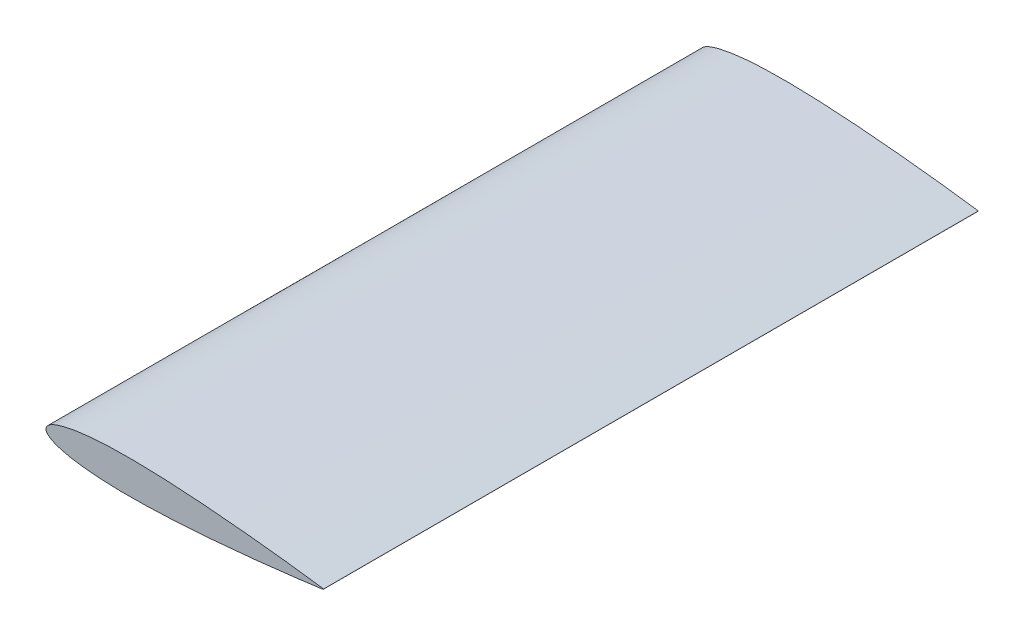
from build123d import *

# Parameters (mm, degrees)
BOSS_EXTRUDE1_DEPTH      = 269.875
BOSS_EXTRUDE1_DEPTH_BACK = 269.875


with BuildPart() as part:
    # Sketch1 → Boss-Extrude1 (new, two sides: drawn at the far end of the back side and taken through both)
    with BuildSketch(Plane.XY.offset(-BOSS_EXTRUDE1_DEPTH_BACK)):
        with BuildLine():
            add(Edge.make_bspline(
                [(-72.489557568, 12.491657943), (-72.489557568, 12.163179949), (-72.395425024, 11.48934067), (-71.973228769, 10.512610279), (-71.283304484, 9.572573657), (-70.334027276, 8.665150808), (-69.12846859, 7.787154489), (-67.668383782, 6.937745813), (-65.955909704, 6.117889867), (-63.994082603, 5.32944509), (-61.786794514, 4.574758302), (-59.3387566, 3.85635786), (-56.655356564, 3.176950344), (-53.742685567, 2.539002195), (-50.607371761, 1.945134105), (-47.256663108, 1.397506799), (-43.698292909, 0.898367729), (-39.940537725, 0.449401961), (-35.992130668, 0.052213203), (-31.862278617, -0.292093372), (-27.560604591, -0.582721332), (-23.097129806, -0.819182723), (-18.482275898, -1.001530379), (-13.726817418, -1.130105181), (-8.841852239, -1.205609716), (-3.838777395, -1.229212817), (1.270721946, -1.202325889), (6.474715491, -1.126707188), (11.761052083, -1.004405679), (17.117399344, -0.837746182), (22.531246658, -0.629162896), (27.989948369, -0.381339327), (33.480760297, -0.097088323), (38.990867431, 0.220726476), (44.507403086, 0.569152494), (50.01748413, 0.945227027), (55.50824848, 1.345997345), (60.966870643, 1.768459367), (66.380605649, 2.209786191), (71.736800946, 2.667094899), (77.022966891, 3.137613816), (82.226742233, 3.618637327), (87.335986279, 4.107466038), (92.33874929, 4.601612401), (97.22337044, 5.098509745), (101.97842058, 5.595742135), (106.592806113, 6.09086461), (111.055740441, 6.581468513), (115.356796488, 7.065355622), (119.485946029, 7.540067147), (123.433537168, 8.003395545), (127.190349685, 8.45306443), (130.74759876, 8.88685816), (134.096991185, 9.302502864), (137.230695421, 9.697903027), (140.141398454, 10.07084708), (142.822290249, 10.419416889), (145.267118152, 10.741489308), (147.470194704, 11.035274343), (149.426288026, 11.299112749), (151.131108503, 11.530867321), (152.579838286, 11.730782347), (153.771480415, 11.892674156), (154.69687643, 12.028725239), (155.369349103, 12.105914128), (155.755667825, 12.1894434), (156.151924325, 12.181894561), (156.151924325, 12.801421326), (155.755667825, 12.793872486), (155.369349103, 12.877401758), (154.69687643, 12.954590647), (153.771480415, 13.09064173), (152.579838286, 13.252533539), (151.131108503, 13.452448565), (149.426288026, 13.684203137), (147.470194704, 13.948041543), (145.267118152, 14.241826578), (142.822290249, 14.563898997), (140.141398454, 14.912468806), (137.230695421, 15.285412859), (134.096991185, 15.680813022), (130.74759876, 16.096457726), (127.190349685, 16.530251456), (123.433537168, 16.979920341), (119.485946029, 17.443248739), (115.356796488, 17.917960264), (111.055740441, 18.401847373), (106.592806113, 18.892451276), (101.97842058, 19.387573751), (97.22337044, 19.884806141), (92.33874929, 20.381703485), (87.335986279, 20.875849848), (82.226742233, 21.364678559), (77.022966891, 21.84570207), (71.736800946, 22.316220987), (66.380605649, 22.773529695), (60.966870643, 23.214856519), (55.50824848, 23.637318541), (50.01748413, 24.038088859), (44.507403086, 24.414163392), (38.990867431, 24.762589411), (33.480760297, 25.080404209), (27.989948369, 25.364655213), (22.531246658, 25.612478782), (17.117399344, 25.821062068), (11.761052083, 25.987721565), (6.474715491, 26.110023074), (1.270721946, 26.185641775), (-3.838777395, 26.212528703), (-8.841852239, 26.188925602), (-13.726817418, 26.113421067), (-18.482275898, 25.984846265), (-23.097129806, 25.80249861), (-27.560604591, 25.566037218), (-31.862278617, 25.275409258), (-35.992130668, 24.931102683), (-39.940537725, 24.533913925), (-43.698292909, 24.084948157), (-47.256663108, 23.585809087), (-50.607371761, 23.038181781), (-53.742685567, 22.444313691), (-56.655356564, 21.806365542), (-59.3387566, 21.126958026), (-61.786794514, 20.408557584), (-63.994082603, 19.653870796), (-65.955909704, 18.865426019), (-67.668383782, 18.045570073), (-69.12846859, 17.196161397), (-70.334027276, 16.318165078), (-71.283304484, 15.410742229), (-71.973228769, 14.470705607), (-72.395425024, 13.493975216), (-72.489557568, 12.820135937), (-72.489557568, 12.491657943)],
                knots=[0, 0, 0, 0, 0.002106168, 0.00432059, 0.006772783, 0.009556697, 0.012734041, 0.016342888, 0.020405604, 0.024934102, 0.029933071, 0.035402241, 0.04133743, 0.04773159, 0.054575389, 0.061857405, 0.069564571, 0.077682311, 0.086194684, 0.095084441, 0.104333244, 0.1139217, 0.123829339, 0.134034708, 0.144515531, 0.155248716, 0.166210356, 0.177375783, 0.188719821, 0.200216647, 0.211839951, 0.223562989, 0.235358653, 0.247199625, 0.259058395, 0.270907226, 0.282718457, 0.294464514, 0.306117689, 0.317650771, 0.329036618, 0.34024851, 0.351259999, 0.362045273, 0.372578891, 0.382836142, 0.392792739, 0.40242532, 0.411711115, 0.420628244, 0.429155673, 0.437273179, 0.444961561, 0.452202575, 0.458979063, 0.465274876, 0.471074963, 0.476365569, 0.481133961, 0.485368768, 0.489059784, 0.492198148, 0.494776266, 0.49678801, 0.498228425, 0.499094073, 0.499382862, 0.500617138, 0.500905927, 0.501771575, 0.50321199, 0.505223734, 0.507801852, 0.510940216, 0.514631232, 0.518866039, 0.523634431, 0.528925037, 0.534725124, 0.541020937, 0.547797425, 0.555038439, 0.562726821, 0.570844327, 0.579371756, 0.588288885, 0.59757468, 0.607207261, 0.617163858, 0.627421109, 0.637954727, 0.648740001, 0.65975149, 0.670963382, 0.682349229, 0.693882311, 0.705535486, 0.717281543, 0.729092774, 0.740941605, 0.752800375, 0.764641347, 0.776437011, 0.788160049, 0.799783353, 0.811280179, 0.822624217, 0.833789644, 0.844751284, 0.855484469, 0.865965292, 0.876170661, 0.8860783, 0.895666756, 0.904915559, 0.913805316, 0.922317689, 0.930435429, 0.938142595, 0.945424611, 0.95226841, 0.95866257, 0.964597759, 0.970066929, 0.975065898, 0.979594396, 0.983657112, 0.987265959, 0.990443303, 0.993227217, 0.99567941, 0.997893832, 1, 1, 1, 1], degree=3))
        make_face()
    extrude(amount=BOSS_EXTRUDE1_DEPTH + BOSS_EXTRUDE1_DEPTH_BACK)


solid = part.part
